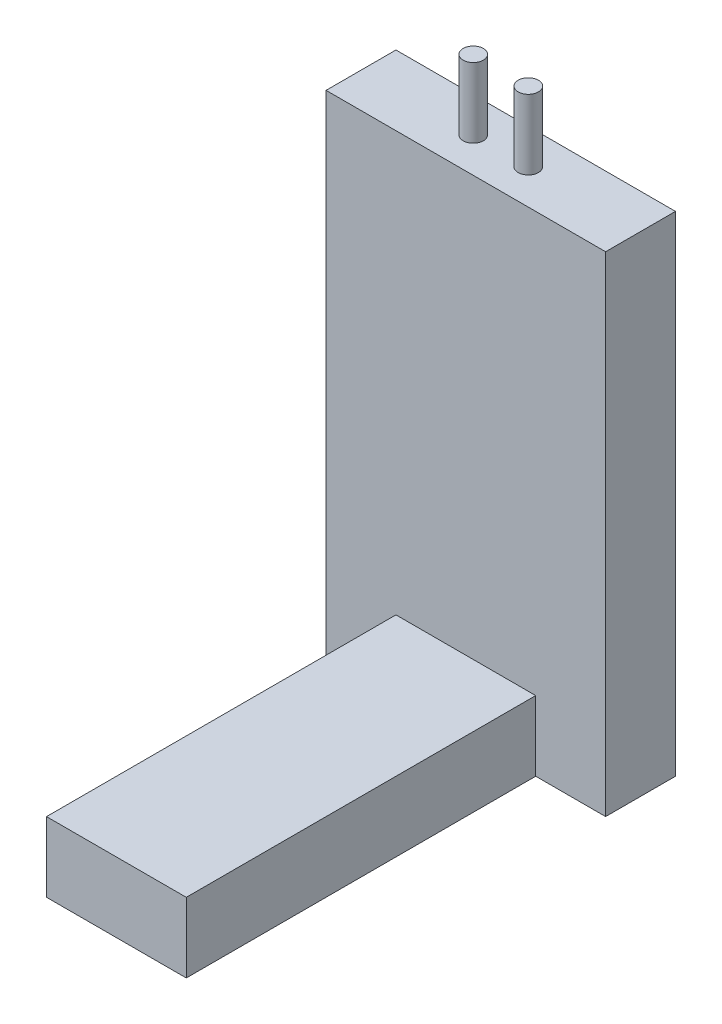
from build123d import *

# Parameters (mm, degrees)
SKETCH3_W           = 101.6
SKETCH3_H           = 25.4
BOSS_EXTRUDE1_DEPTH = 177.8
SKETCH6_R           = 3.683
BOSS_EXTRUDE4_DEPTH = 25.4
SKETCH7_R           = 5.207
CUT_EXTRUDE1_DEPTH  = 17.78
SKETCH8_W           = 50.8
SKETCH8_H           = 25.4
BOSS_EXTRUDE5_DEPTH = 127


with BuildPart() as part:
    # Sketch3 → Boss-Extrude1 (new body)
    with BuildSketch(Plane(origin=(0, 0, 0), x_dir=(1, 0, 0), z_dir=(0, 1, 0))):
        with Locations((25.4, 12.7)):
            Rectangle(SKETCH3_W, SKETCH3_H)
    extrude(amount=BOSS_EXTRUDE1_DEPTH)

    # Sketch6 → Boss-Extrude4 (add)
    with BuildSketch(Plane(origin=(0, 177.8, 0), x_dir=(1, 0, 0), z_dir=(0, 1, 0))):
        with Locations((15.4, 12.7)):
            Circle(SKETCH6_R)
        with Locations((35.4, 12.7)):
            Circle(SKETCH6_R)
    extrude(amount=BOSS_EXTRUDE4_DEPTH)

    # Sketch7 → Cut-Extrude1 (cut)
    with BuildSketch(Plane(origin=(0, 0, 0), x_dir=(-1, 0, 0), z_dir=(0, -1, 0))):
        with Locations((5.08, 12.7)):
            Circle(SKETCH7_R)
        with Locations((-55.88, 12.7)):
            Circle(SKETCH7_R)
    extrude(amount=-CUT_EXTRUDE1_DEPTH, mode=Mode.SUBTRACT)

    # Sketch8 → Boss-Extrude5 (add)
    with BuildSketch(Plane.XY):
        with Locations((25.4, 12.7)):
            Rectangle(SKETCH8_W, SKETCH8_H)
    extrude(amount=BOSS_EXTRUDE5_DEPTH)


solid = part.part
